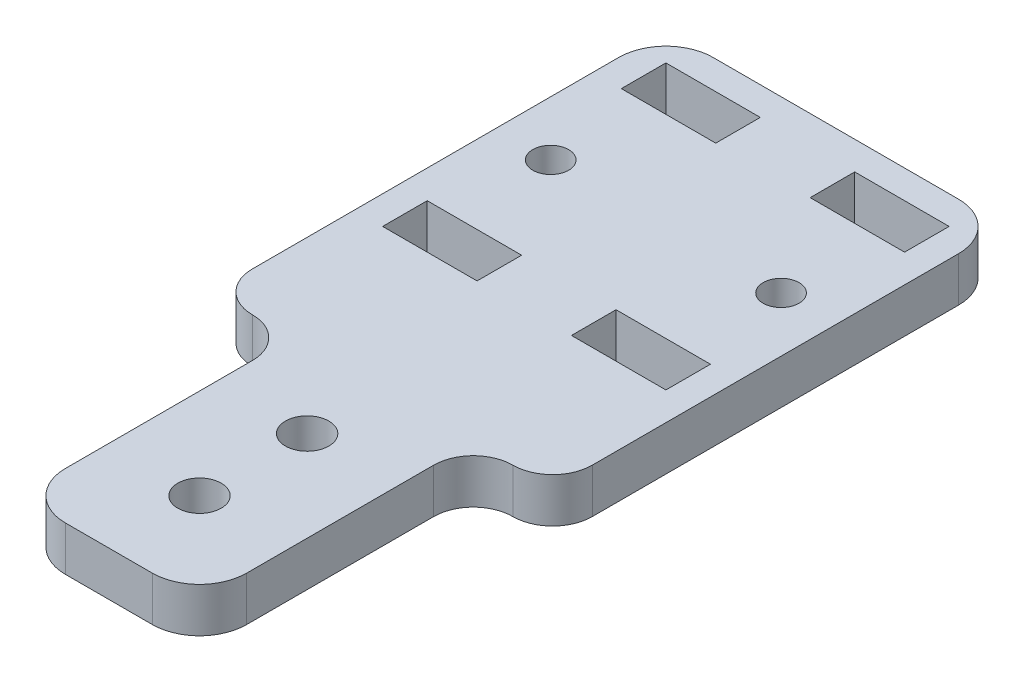
from build123d import *

# Parameters (mm, degrees)
SKETCH1_R           = 1.2065
SKETCH1_R_2         = 1.4605
SKETCH1_W           = 6.35
SKETCH1_H           = 2.9972
BOSS_EXTRUDE1_DEPTH = 2.9972
FILLET1_R           = 3.175
FILLET2_START       = -1
FILLET2_DEPTH       = 5
FILLET2_2_DEPTH     = 2.9972


with BuildPart() as part:
    # Sketch1 → Boss-Extrude1 (new body)
    with BuildSketch(Plane(origin=(0, 0, 0), x_dir=(1, 0, 0), z_dir=(0, 1, 0))):
        Polygon((-11.43, -11.43), (-11.43, -19.05), (-6.096, -19.05), (-6.096, -37.465), (0, -37.465), (6.096, -37.465), (6.096, -19.05), (11.43, -19.05), (11.43, -11.43), (11.43, 11.43), (-11.43, 11.43), align=None)
        with Locations(Location((-7.747, 0, 0), (0, 0, 90))):
            Circle(SKETCH1_R, mode=Mode.SUBTRACT)
        with Locations(Location((7.747, 0, 0), (0, 0, 90))):
            Circle(SKETCH1_R, mode=Mode.SUBTRACT)
        with Locations(Location((0, -24.13, 0), (0, 0, 90))):
            Circle(SKETCH1_R_2, mode=Mode.SUBTRACT)
        with Locations(Location((0, -31.369, 0), (0, 0, 90))):
            Circle(SKETCH1_R_2, mode=Mode.SUBTRACT)
        with Locations((6.35, 8.0264)):
            Rectangle(SKETCH1_W, SKETCH1_H, mode=Mode.SUBTRACT)
        with Locations((-6.35, -8.0264)):
            Rectangle(SKETCH1_W, SKETCH1_H, mode=Mode.SUBTRACT)
        with Locations((6.35, -8.0264)):
            Rectangle(SKETCH1_W, SKETCH1_H, mode=Mode.SUBTRACT)
        with Locations((-6.35, 8.0264)):
            Rectangle(SKETCH1_W, SKETCH1_H, mode=Mode.SUBTRACT)
    extrude(amount=BOSS_EXTRUDE1_DEPTH)

    # Fillet1
    fillet1_edges = [part.edges().sort_by_distance(p)[0] for p in [
        (-6.096, 1.4986, 37.465),
        (-11.43, 1.4986, -11.43),
        (11.43, 1.4986, -11.43),
        (6.096, 1.4986, 37.465),
    ]]
    fillet(fillet1_edges, radius=FILLET1_R)

    # Fillet2: read off the stored shape, not the designer's step
    # Fillet2 outline → Fillet2 (cut)
    with BuildSketch(Plane(origin=(0, 0, 0), x_dir=(1, 0, 0), z_dir=(0, 1, 0)).offset(FILLET2_START)):
        with BuildLine():
            ThreePointArc((11.43, -16.383), (10.648853785, -18.268853785), (8.763, -19.05))
            Line((8.763, -19.05), (11.43, -19.05))
            Line((11.43, -19.05), (11.43, -16.383))
        make_face()
        with BuildLine():
            Line((-11.43, -19.05), (-8.763, -19.05))
            ThreePointArc((-8.763, -19.05), (-10.648853785, -18.268853785), (-11.43, -16.383))
            Line((-11.43, -16.383), (-11.43, -19.05))
        make_face()
    extrude(amount=FILLET2_DEPTH, mode=Mode.SUBTRACT)

    # Fillet2 2 outline → Fillet2 2 (add)
    with BuildSketch(Plane(origin=(0, 0, 0), x_dir=(1, 0, 0), z_dir=(0, 1, 0))):
        with BuildLine():
            ThreePointArc((6.096, -21.717), (6.877146215, -19.831146215), (8.763, -19.05))
            Line((8.763, -19.05), (6.096, -19.05))
            Line((6.096, -19.05), (6.096, -21.717))
        make_face()
        with BuildLine():
            Line((-6.096, -19.05), (-8.763, -19.05))
            ThreePointArc((-8.763, -19.05), (-6.877146215, -19.831146215), (-6.096, -21.717))
            Line((-6.096, -21.717), (-6.096, -19.05))
        make_face()
    extrude(amount=FILLET2_2_DEPTH)


solid = part.part
